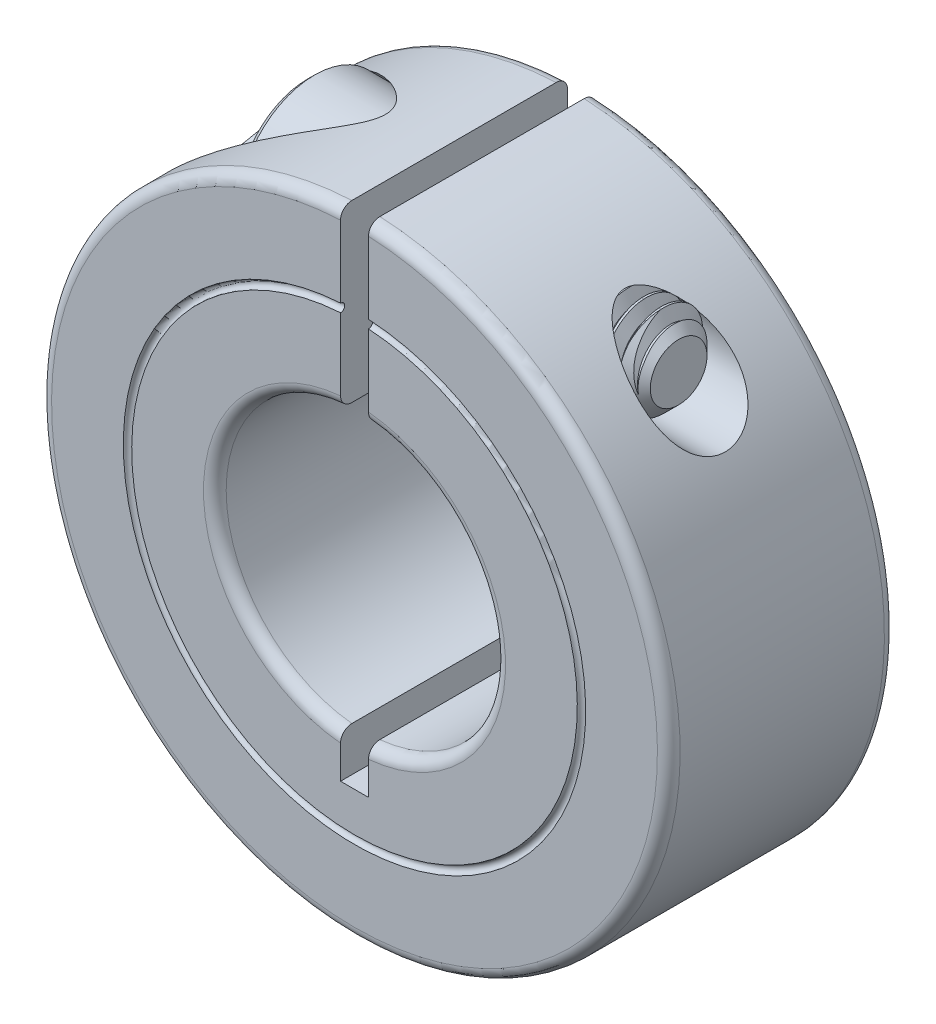
from build123d import *

# Parameters (mm, degrees)
EXTRUDE1_DEPTH     = 5.159375
FILLET1_R          = 0.5159375
CUT_EXTRUDE1_DEPTH = 3.571875
CHAMFER1_SIZE      = 0.3175
CHAMFER2_SIZE      = 0.79375
CUT_SWEEP1_PITCH   = 0.79375


with BuildPart() as part:
    # Sketch1 → Extrude1 (new, symmetric)
    with BuildSketch(Plane.XY):
        with BuildLine():
            Line((-0.635, 6.318170226), (-0.635, 14.273381914))
            ThreePointArc((-0.635, 14.273381914), (0, -14.2875), (0.635, 14.273381914))
            Line((0.635, 14.273381914), (0.635, 6.318170226))
            ThreePointArc((0.635, 6.318170226), (6.35, 0), (0.635, -6.318170226))
            Line((0.635, -6.318170226), (0.635, -8.334375))
            Line((0.635, -8.334375), (-0.635, -8.334375))
            Line((-0.635, -8.334375), (-0.635, -6.318170226))
            ThreePointArc((-0.635, -6.318170226), (-6.35, 0), (-0.635, 6.318170226))
        make_face()
    extrude(amount=EXTRUDE1_DEPTH, both=True)

    # Fillet1
    fillet1_edges = [part.edges().sort_by_distance(p)[0] for p in [
        (-6.35, 0, 5.159375),
        (0, -14.2875, 5.159375),
        (6.35, 0, 5.159375),
        (6.35, 0, -5.159375),
        (0, -14.2875, -5.159375),
        (-6.35, 0, -5.159375),
    ]]
    fillet(fillet1_edges, radius=FILLET1_R)

    # Sketch2 → Cut-Revolve1 (revolve, cut)
    with BuildSketch(Plane(origin=(0, 0, 0), x_dir=(1, 0, 0), z_dir=(0, 1, 0))):
        with BuildLine():
            Line((-10.50925, -5.159375), (-10.12825, -5.159375))
            ThreePointArc((-10.12825, -5.159375), (-10.31875, -4.968875), (-10.50925, -5.159375))
        make_face()
    revolve(axis=Axis((0, 0, -5.159375), (0, 0, 1)), mode=Mode.SUBTRACT)

    # Sketch3 → Cut-Revolve2 (revolve, cut)
    with BuildSketch(Plane.XY, mode=Mode.PRIVATE) as cut_revolve2_sk:
        Polygon((14.2875, 10.29577607), (-14.2875, 10.29577607), (-14.2875, 6.80327607), (-3.1242, 6.80327607), (-3.1242, 8.21297607), (14.2875, 8.21297607), align=None)
    revolve(cut_revolve2_sk.sketch.rotate(Axis((-14.2875, 10.29577607, 0), (-1, 0, 0)), 180), axis=Axis((-14.2875, 10.29577607, 0), (-1, 0, 0)), mode=Mode.SUBTRACT)


with BuildPart() as body_2:
    # Sketch4 → Revolve1 (revolve)
    with BuildSketch(Plane.XY):
        Polygon((-7.2898, 10.29577607), (-7.2898, 13.72477607), (-3.1242, 13.72477607), (-3.1242, 12.37857607), (9.5758, 12.37857607), (9.5758, 10.29577607), align=None)
    revolve(axis=Axis((9.5758, 10.29577607, 0), (-1, 0, 0)))

    # Sketch5 → Cut-Extrude1 (cut)
    with BuildSketch(Plane(origin=(-7.2898, 0, 0), x_dir=(0, -1, 0), z_dir=(-1, 0, 0))):
        Polygon((-9.264664573, -1.7859375), (-8.233553077, 0), (-9.264664573, 1.7859375), (-11.326887566, 1.7859375), (-12.357999062, 0), (-11.326887566, -1.7859375), align=None)
    extrude(amount=-CUT_EXTRUDE1_DEPTH, mode=Mode.SUBTRACT)

    # Chamfer1
    chamfer1_edges = [body_2.edges().sort_by_distance(p)[0] for p in [
        (-7.2898, 6.86677607, 0),
    ]]
    chamfer(chamfer1_edges, length=CHAMFER1_SIZE)

    # Chamfer2
    chamfer2_edges = [body_2.edges().sort_by_distance(p)[0] for p in [
        (9.5758, 8.21297607, 0),
    ]]
    chamfer(chamfer2_edges, length=CHAMFER2_SIZE)

    # Cut-Sweep1: arcs per turn and ends read off the stored shape
    # Cut-Sweep1: the profile of Sketch7 screwed along a right-hand helix through 16 turns, 8 arcs to a turn; built about Z, then put on its axis
    cut_sweep1_z = Axis((0, 0, 0), (0, 0, 1))
    cut_sweep1_corners = [(1.567244252, -2.74e-07, -0.496093772), (1.567244252, -2.74e-07, -0.595312522), (2.125762979, -3.71e-07, -0.91777346), (2.125762979, -3.71e-07, -0.173632835)]
    with BuildLine(mode=Mode.PRIVATE) as cut_sweep1_profile:
        Line(cut_sweep1_corners[0], cut_sweep1_corners[1])
        Line(cut_sweep1_corners[1], cut_sweep1_corners[2])
        Line(cut_sweep1_corners[2], cut_sweep1_corners[3])
        Line(cut_sweep1_corners[3], cut_sweep1_corners[0])
    cut_sweep1_cap = Face(cut_sweep1_profile.wire())
    cut_sweep1_turn_angles = [0, 22.5, 45, 67.5, 90, 112.5, 135, 157.5, 180, 202.5, 225, 247.5, 270, 292.5, 315, 337.5, 360]
    cut_sweep1_turn_weights = [1, 0.9238795325112867, 1, 0.9238795325112867, 1, 0.9238795325112867, 1, 0.9238795325112867, 1, 0.9238795325112867, 1, 0.9238795325112867, 1, 0.9238795325112867, 1, 0.9238795325112867, 1]
    cut_sweep1_turn_rails = [Edge.make_bspline([Vector(p[0], p[1], 0).rotate(cut_sweep1_z, cut_sweep1_turn_angles[k]) / cut_sweep1_turn_weights[k] + Vector(0, 0, p[2] + CUT_SWEEP1_PITCH * cut_sweep1_turn_angles[k] / 360) for k in range(17)], [0, 0, 0, 1, 1, 2, 2, 3, 3, 4, 4, 5, 5, 6, 6, 7, 7, 8, 8, 8], 2, cut_sweep1_turn_weights) for p in cut_sweep1_corners]
    cut_sweep1_turn_sides = [Face.make_surface_from_curves(cut_sweep1_turn_rails[p[0]], cut_sweep1_turn_rails[p[1]]) for p in [(0, 1), (1, 2), (2, 3), (3, 0)]]
    cut_sweep1 = Plane(origin=(9.5758, 10.29577607, 0), x_dir=(0, 0, 1), z_dir=(-1, 0, 0)) * Solid(Shell([*[p.moved(Location((0, 0, CUT_SWEEP1_PITCH * i))) for i in range(16) for p in cut_sweep1_turn_sides], cut_sweep1_cap, cut_sweep1_cap.rotate(cut_sweep1_z, 5760).moved(Location((0, 0, CUT_SWEEP1_PITCH * 5760 / 360)))]))
    add(cut_sweep1, mode=Mode.SUBTRACT)


solid = Compound([part.part, body_2.part])
